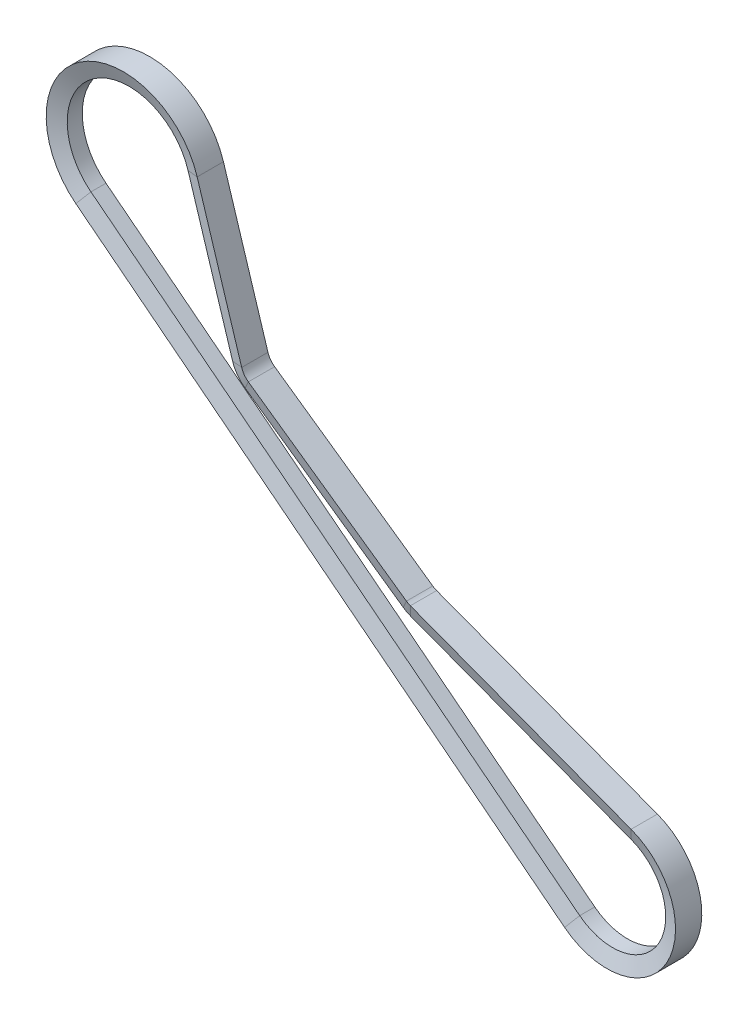
from build123d import *


with BuildPart() as part:
    # Sweep1: sweep along a path in Sketch2
    with BuildLine(Plane.XY) as sweep1_path:
        Line((-15.328170814, -19.591141013), (-192.517378708, 119.042256772))
        ThreePointArc((-192.517378708, 119.042256772), (-191.179020955, 164.131480908), (-148.532946046, 149.429724905))
        Line((-148.532946046, 149.429724905), (-132.394305941, 97.673386698))
        ThreePointArc((-132.394305941, 97.673386698), (-131.460175791, 95.818516585), (-129.977524242, 94.364251596))
        Line((-129.977524242, 94.364251596), (-72.661048249, 54.179408935))
        ThreePointArc((-72.661048249, 54.179408935), (-71.98140076, 53.763925873), (-71.255082789, 53.436803436))
        Line((-71.255082789, 53.436803436), (8.772350285, 23.276844657))
        ThreePointArc((8.772350285, 23.276844657), (21.683190368, -12.190360214), (-15.328170814, -19.591141013))
    # Sketch3 → Sweep1 (sweep)
    with BuildSketch(Plane(origin=(8.772350285, 23.276844657, 0), x_dir=(-0.3526572974167111, -0.9357525477276252, 0), z_dir=(0.9357525477276252, -0.3526572974167111, 0))):
        Polygon((0, -4.7625), (0, 4.7625), (5.588, 2.728634331), (5.588, -2.728634331), align=None)
    sweep(path=sweep1_path.line)


solid = part.part
